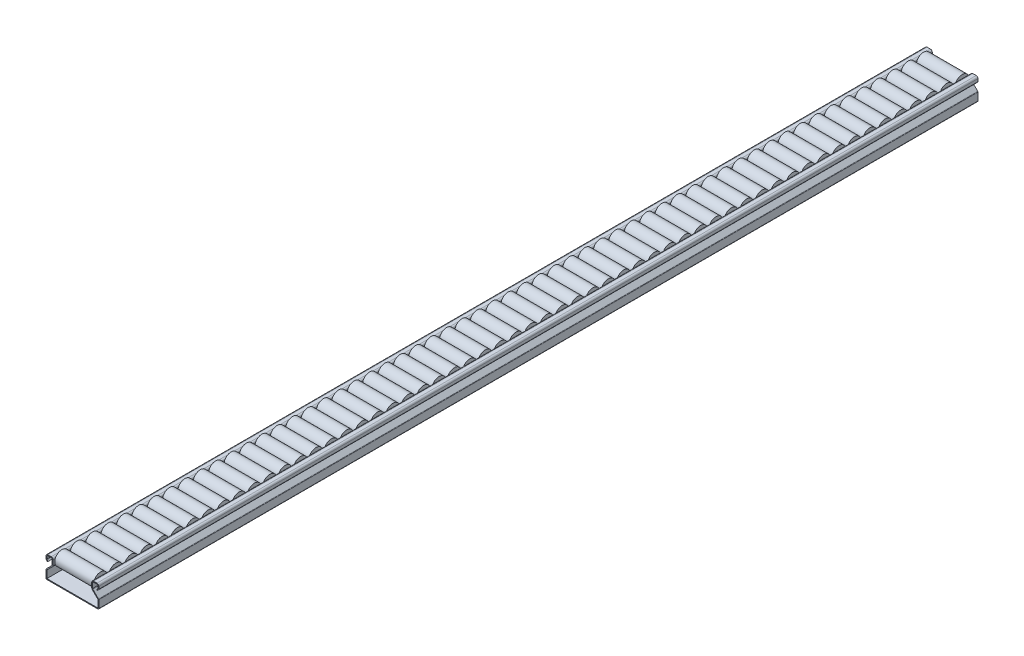
from build123d import *

# Parameters (mm, degrees)
BOSS_EXTRUDE1_DEPTH = 1000
CUT_EXTRUDE1_DEPTH  = 1001.762209518
CUT_EXTRUDE2_DEPTH  = 1001.762209518
SKETCH4_W           = 44
SKETCH4_H           = 8
SKETCH5_W           = 44
SKETCH5_H           = 8
SKETCH6_W           = 44
SKETCH6_H           = 8
SKETCH7_W           = 44
SKETCH7_H           = 8
SKETCH8_W           = 44
SKETCH8_H           = 8
SKETCH9_W           = 44
SKETCH9_H           = 8
SKETCH10_W          = 44
SKETCH10_H          = 8
SKETCH11_W          = 44
SKETCH11_H          = 8
SKETCH12_W          = 44
SKETCH12_H          = 8
SKETCH13_W          = 44
SKETCH13_H          = 8
SKETCH14_W          = 44
SKETCH14_H          = 8
SKETCH15_W          = 44
SKETCH15_H          = 8
SKETCH16_W          = 44
SKETCH16_H          = 8
SKETCH17_W          = 44
SKETCH17_H          = 8
SKETCH18_W          = 44
SKETCH18_H          = 8
SKETCH19_W          = 44
SKETCH19_H          = 8
SKETCH20_W          = 44
SKETCH20_H          = 8
SKETCH21_W          = 44
SKETCH21_H          = 8
SKETCH22_W          = 44
SKETCH22_H          = 8
SKETCH23_W          = 44
SKETCH23_H          = 8
SKETCH24_W          = 44
SKETCH24_H          = 8
SKETCH25_W          = 44
SKETCH25_H          = 8
SKETCH26_W          = 44
SKETCH26_H          = 8
SKETCH27_W          = 44
SKETCH27_H          = 8
SKETCH28_W          = 44
SKETCH28_H          = 8
SKETCH29_W          = 44
SKETCH29_H          = 8
SKETCH30_W          = 44
SKETCH30_H          = 8
SKETCH31_W          = 44
SKETCH31_H          = 8
SKETCH32_W          = 44
SKETCH32_H          = 8
SKETCH33_W          = 44
SKETCH33_H          = 8
SKETCH34_W          = 44
SKETCH34_H          = 8
SKETCH35_W          = 44
SKETCH35_H          = 8
SKETCH36_W          = 44
SKETCH36_H          = 8
SKETCH37_W          = 44
SKETCH37_H          = 8
SKETCH38_W          = 44
SKETCH38_H          = 8
SKETCH39_W          = 44
SKETCH39_H          = 8
SKETCH40_W          = 44
SKETCH40_H          = 8
SKETCH41_W          = 44
SKETCH41_H          = 8
SKETCH42_W          = 44
SKETCH42_H          = 8
SKETCH43_W          = 44
SKETCH43_H          = 8
SKETCH44_W          = 44
SKETCH44_H          = 8
SKETCH45_W          = 44
SKETCH45_H          = 8
SKETCH46_W          = 44
SKETCH46_H          = 8
SKETCH47_W          = 44
SKETCH47_H          = 8
SKETCH48_W          = 44
SKETCH48_H          = 8
SKETCH49_W          = 44
SKETCH49_H          = 8
SKETCH50_W          = 44
SKETCH50_H          = 8
SKETCH51_W          = 44
SKETCH51_H          = 8
SKETCH52_W          = 44
SKETCH52_H          = 8
SKETCH53_W          = 44
SKETCH53_H          = 8
SKETCH54_W          = 44
SKETCH54_H          = 8
SKETCH55_W          = 44
SKETCH55_H          = 8
SKETCH56_W          = 44
SKETCH56_H          = 8
SKETCH57_W          = 44
SKETCH57_H          = 8
SKETCH58_W          = 44
SKETCH58_H          = 8
SKETCH59_W          = 44
SKETCH59_H          = 8
SKETCH60_W          = 44
SKETCH60_H          = 8
FILLET1_R           = 1
FILLET2_R           = 2


with BuildPart() as part:
    # Sketch1 → Boss-Extrude1 (new body)
    with BuildSketch(Plane.XY.offset(1000)):
        with BuildLine():
            Line((30, 0), (30, 25))
            Line((30, 25), (24, 25))
            ThreePointArc((24, 25), (22.585786438, 24.414213562), (22, 23))
            Line((22, 23), (22, 17.414213562))
            ThreePointArc((22, 17.414213562), (22.152240935, 16.648846698), (22.585786438, 16))
            Line((22.585786438, 16), (29, 9.585786438))
            Line((29, 9.585786438), (29, 1))
            Line((29, 1), (-29, 1))
            Line((-29, 1), (-29, 9.585786438))
            Line((-29, 9.585786438), (-22.585786438, 16))
            ThreePointArc((-22.585786438, 16), (-22.152240935, 16.648846698), (-22, 17.414213562))
            Line((-22, 17.414213562), (-22, 23))
            ThreePointArc((-22, 23), (-22.585786438, 24.414213562), (-24, 25))
            Line((-24, 25), (-30, 25))
            Line((-30, 25), (-30, 0))
            Line((-30, 0), (30, 0))
        make_face()
    extrude(amount=-BOSS_EXTRUDE1_DEPTH)

    # Sketch2 → Cut-Extrude1 (cut, through all)
    with BuildSketch(Plane(origin=(0, 0, 0), x_dir=(-1, 0, 0), z_dir=(0, 0, -1))):
        Polygon((30, 10), (30, 19.585786438), (28.292893219, 17.878679656), (27.585786438, 18.585786438), (29, 20), (29, 24), (23, 24), (23, 17), align=None)
    extrude(amount=-CUT_EXTRUDE1_DEPTH, mode=Mode.SUBTRACT)

    # Sketch3 → Cut-Extrude2 (cut, through all)
    with BuildSketch(Plane(origin=(0, 0, 0), x_dir=(-1, 0, 0), z_dir=(0, 0, -1))):
        Polygon((-30, 19.585786438), (-30, 10), (-23, 17), (-23, 24), (-29, 24), (-29, 20), (-27.585786438, 18.585786438), (-28.292893219, 17.878679656), align=None)
    extrude(amount=-CUT_EXTRUDE2_DEPTH, mode=Mode.SUBTRACT)

    # Sketch4 → Revolve1 (revolve)
    with BuildSketch(Plane(origin=(0, 0, 10), x_dir=(-1, 0, 0), z_dir=(0, 0, -1))):
        with Locations((0, 24)):
            Rectangle(SKETCH4_W, SKETCH4_H)
    revolve(axis=Axis((22, 20, 10), (-1, 0, 0)))

    # Sketch5 → Revolve2 (revolve)
    with BuildSketch(Plane(origin=(0, 0, 990), x_dir=(-1, 0, 0), z_dir=(0, 0, -1))):
        with Locations((0, 24)):
            Rectangle(SKETCH5_W, SKETCH5_H)
    revolve(axis=Axis((22, 20, 990), (-1, 0, 0)))

    # Sketch6 → Revolve3 (revolve)
    with BuildSketch(Plane(origin=(0, 0, 27.5), x_dir=(-1, 0, 0), z_dir=(0, 0, -1))):
        with Locations((0, 24)):
            Rectangle(SKETCH6_W, SKETCH6_H)
    revolve(axis=Axis((22, 20, 27.5), (-1, 0, 0)))

    # Sketch7 → Revolve4 (revolve)
    with BuildSketch(Plane(origin=(0, 0, 45), x_dir=(-1, 0, 0), z_dir=(0, 0, -1))):
        with Locations((0, 24)):
            Rectangle(SKETCH7_W, SKETCH7_H)
    revolve(axis=Axis((22, 20, 45), (-1, 0, 0)))

    # Sketch8 → Revolve5 (revolve)
    with BuildSketch(Plane(origin=(0, 0, 62.5), x_dir=(-1, 0, 0), z_dir=(0, 0, -1))):
        with Locations((0, 24)):
            Rectangle(SKETCH8_W, SKETCH8_H)
    revolve(axis=Axis((22, 20, 62.5), (-1, 0, 0)))

    # Sketch9 → Revolve6 (revolve)
    with BuildSketch(Plane(origin=(0, 0, 80), x_dir=(-1, 0, 0), z_dir=(0, 0, -1))):
        with Locations((0, 24)):
            Rectangle(SKETCH9_W, SKETCH9_H)
    revolve(axis=Axis((22, 20, 80), (-1, 0, 0)))

    # Sketch10 → Revolve7 (revolve)
    with BuildSketch(Plane(origin=(0, 0, 97.5), x_dir=(-1, 0, 0), z_dir=(0, 0, -1))):
        with Locations((0, 24)):
            Rectangle(SKETCH10_W, SKETCH10_H)
    revolve(axis=Axis((22, 20, 97.5), (-1, 0, 0)))

    # Sketch11 → Revolve8 (revolve)
    with BuildSketch(Plane(origin=(0, 0, 115), x_dir=(-1, 0, 0), z_dir=(0, 0, -1))):
        with Locations((0, 24)):
            Rectangle(SKETCH11_W, SKETCH11_H)
    revolve(axis=Axis((22, 20, 115), (-1, 0, 0)))

    # Sketch12 → Revolve9 (revolve)
    with BuildSketch(Plane(origin=(0, 0, 132.5), x_dir=(-1, 0, 0), z_dir=(0, 0, -1))):
        with Locations((0, 24)):
            Rectangle(SKETCH12_W, SKETCH12_H)
    revolve(axis=Axis((22, 20, 132.5), (-1, 0, 0)))

    # Sketch13 → Revolve10 (revolve)
    with BuildSketch(Plane(origin=(0, 0, 150), x_dir=(-1, 0, 0), z_dir=(0, 0, -1))):
        with Locations((0, 24)):
            Rectangle(SKETCH13_W, SKETCH13_H)
    revolve(axis=Axis((22, 20, 150), (-1, 0, 0)))

    # Sketch14 → Revolve11 (revolve)
    with BuildSketch(Plane(origin=(0, 0, 167.5), x_dir=(-1, 0, 0), z_dir=(0, 0, -1))):
        with Locations((0, 24)):
            Rectangle(SKETCH14_W, SKETCH14_H)
    revolve(axis=Axis((22, 20, 167.5), (-1, 0, 0)))

    # Sketch15 → Revolve12 (revolve)
    with BuildSketch(Plane(origin=(0, 0, 185), x_dir=(-1, 0, 0), z_dir=(0, 0, -1))):
        with Locations((0, 24)):
            Rectangle(SKETCH15_W, SKETCH15_H)
    revolve(axis=Axis((22, 20, 185), (-1, 0, 0)))

    # Sketch16 → Revolve13 (revolve)
    with BuildSketch(Plane(origin=(0, 0, 202.5), x_dir=(-1, 0, 0), z_dir=(0, 0, -1))):
        with Locations((0, 24)):
            Rectangle(SKETCH16_W, SKETCH16_H)
    revolve(axis=Axis((22, 20, 202.5), (-1, 0, 0)))

    # Sketch17 → Revolve14 (revolve)
    with BuildSketch(Plane(origin=(0, 0, 220), x_dir=(-1, 0, 0), z_dir=(0, 0, -1))):
        with Locations((0, 24)):
            Rectangle(SKETCH17_W, SKETCH17_H)
    revolve(axis=Axis((22, 20, 220), (-1, 0, 0)))

    # Sketch18 → Revolve15 (revolve)
    with BuildSketch(Plane(origin=(0, 0, 237.5), x_dir=(-1, 0, 0), z_dir=(0, 0, -1))):
        with Locations((0, 24)):
            Rectangle(SKETCH18_W, SKETCH18_H)
    revolve(axis=Axis((22, 20, 237.5), (-1, 0, 0)))

    # Sketch19 → Revolve16 (revolve)
    with BuildSketch(Plane(origin=(0, 0, 255), x_dir=(-1, 0, 0), z_dir=(0, 0, -1))):
        with Locations((0, 24)):
            Rectangle(SKETCH19_W, SKETCH19_H)
    revolve(axis=Axis((22, 20, 255), (-1, 0, 0)))

    # Sketch20 → Revolve17 (revolve)
    with BuildSketch(Plane(origin=(0, 0, 272.5), x_dir=(-1, 0, 0), z_dir=(0, 0, -1))):
        with Locations((0, 24)):
            Rectangle(SKETCH20_W, SKETCH20_H)
    revolve(axis=Axis((22, 20, 272.5), (-1, 0, 0)))

    # Sketch21 → Revolve18 (revolve)
    with BuildSketch(Plane(origin=(0, 0, 290), x_dir=(-1, 0, 0), z_dir=(0, 0, -1))):
        with Locations((0, 24)):
            Rectangle(SKETCH21_W, SKETCH21_H)
    revolve(axis=Axis((22, 20, 290), (-1, 0, 0)))

    # Sketch22 → Revolve19 (revolve)
    with BuildSketch(Plane(origin=(0, 0, 307.5), x_dir=(-1, 0, 0), z_dir=(0, 0, -1))):
        with Locations((0, 24)):
            Rectangle(SKETCH22_W, SKETCH22_H)
    revolve(axis=Axis((22, 20, 307.5), (-1, 0, 0)))

    # Sketch23 → Revolve20 (revolve)
    with BuildSketch(Plane(origin=(0, 0, 325), x_dir=(-1, 0, 0), z_dir=(0, 0, -1))):
        with Locations((0, 24)):
            Rectangle(SKETCH23_W, SKETCH23_H)
    revolve(axis=Axis((22, 20, 325), (-1, 0, 0)))

    # Sketch24 → Revolve21 (revolve)
    with BuildSketch(Plane(origin=(0, 0, 342.5), x_dir=(-1, 0, 0), z_dir=(0, 0, -1))):
        with Locations((0, 24)):
            Rectangle(SKETCH24_W, SKETCH24_H)
    revolve(axis=Axis((22, 20, 342.5), (-1, 0, 0)))

    # Sketch25 → Revolve22 (revolve)
    with BuildSketch(Plane(origin=(0, 0, 360), x_dir=(-1, 0, 0), z_dir=(0, 0, -1))):
        with Locations((0, 24)):
            Rectangle(SKETCH25_W, SKETCH25_H)
    revolve(axis=Axis((22, 20, 360), (-1, 0, 0)))

    # Sketch26 → Revolve23 (revolve)
    with BuildSketch(Plane(origin=(0, 0, 377.5), x_dir=(-1, 0, 0), z_dir=(0, 0, -1))):
        with Locations((0, 24)):
            Rectangle(SKETCH26_W, SKETCH26_H)
    revolve(axis=Axis((22, 20, 377.5), (-1, 0, 0)))

    # Sketch27 → Revolve24 (revolve)
    with BuildSketch(Plane(origin=(0, 0, 395), x_dir=(-1, 0, 0), z_dir=(0, 0, -1))):
        with Locations((0, 24)):
            Rectangle(SKETCH27_W, SKETCH27_H)
    revolve(axis=Axis((22, 20, 395), (-1, 0, 0)))

    # Sketch28 → Revolve25 (revolve)
    with BuildSketch(Plane(origin=(0, 0, 412.5), x_dir=(-1, 0, 0), z_dir=(0, 0, -1))):
        with Locations((0, 24)):
            Rectangle(SKETCH28_W, SKETCH28_H)
    revolve(axis=Axis((22, 20, 412.5), (-1, 0, 0)))

    # Sketch29 → Revolve26 (revolve)
    with BuildSketch(Plane(origin=(0, 0, 430), x_dir=(-1, 0, 0), z_dir=(0, 0, -1))):
        with Locations((0, 24)):
            Rectangle(SKETCH29_W, SKETCH29_H)
    revolve(axis=Axis((22, 20, 430), (-1, 0, 0)))

    # Sketch30 → Revolve27 (revolve)
    with BuildSketch(Plane(origin=(0, 0, 447.5), x_dir=(-1, 0, 0), z_dir=(0, 0, -1))):
        with Locations((0, 24)):
            Rectangle(SKETCH30_W, SKETCH30_H)
    revolve(axis=Axis((22, 20, 447.5), (-1, 0, 0)))

    # Sketch31 → Revolve28 (revolve)
    with BuildSketch(Plane(origin=(0, 0, 465), x_dir=(-1, 0, 0), z_dir=(0, 0, -1))):
        with Locations((0, 24)):
            Rectangle(SKETCH31_W, SKETCH31_H)
    revolve(axis=Axis((22, 20, 465), (-1, 0, 0)))

    # Sketch32 → Revolve29 (revolve)
    with BuildSketch(Plane(origin=(0, 0, 482.5), x_dir=(-1, 0, 0), z_dir=(0, 0, -1))):
        with Locations((0, 24)):
            Rectangle(SKETCH32_W, SKETCH32_H)
    revolve(axis=Axis((22, 20, 482.5), (-1, 0, 0)))

    # Sketch33 → Revolve30 (revolve)
    with BuildSketch(Plane(origin=(0, 0, 500), x_dir=(-1, 0, 0), z_dir=(0, 0, -1))):
        with Locations((0, 24)):
            Rectangle(SKETCH33_W, SKETCH33_H)
    revolve(axis=Axis((22, 20, 500), (-1, 0, 0)))

    # Sketch34 → Revolve31 (revolve)
    with BuildSketch(Plane(origin=(0, 0, 517.5), x_dir=(-1, 0, 0), z_dir=(0, 0, -1))):
        with Locations((0, 24)):
            Rectangle(SKETCH34_W, SKETCH34_H)
    revolve(axis=Axis((22, 20, 517.5), (-1, 0, 0)))

    # Sketch35 → Revolve32 (revolve)
    with BuildSketch(Plane(origin=(0, 0, 535), x_dir=(-1, 0, 0), z_dir=(0, 0, -1))):
        with Locations((0, 24)):
            Rectangle(SKETCH35_W, SKETCH35_H)
    revolve(axis=Axis((22, 20, 535), (-1, 0, 0)))

    # Sketch36 → Revolve33 (revolve)
    with BuildSketch(Plane(origin=(0, 0, 552.5), x_dir=(-1, 0, 0), z_dir=(0, 0, -1))):
        with Locations((0, 24)):
            Rectangle(SKETCH36_W, SKETCH36_H)
    revolve(axis=Axis((22, 20, 552.5), (-1, 0, 0)))

    # Sketch37 → Revolve34 (revolve)
    with BuildSketch(Plane(origin=(0, 0, 570), x_dir=(-1, 0, 0), z_dir=(0, 0, -1))):
        with Locations((0, 24)):
            Rectangle(SKETCH37_W, SKETCH37_H)
    revolve(axis=Axis((22, 20, 570), (-1, 0, 0)))

    # Sketch38 → Revolve35 (revolve)
    with BuildSketch(Plane(origin=(0, 0, 587.5), x_dir=(-1, 0, 0), z_dir=(0, 0, -1))):
        with Locations((0, 24)):
            Rectangle(SKETCH38_W, SKETCH38_H)
    revolve(axis=Axis((22, 20, 587.5), (-1, 0, 0)))

    # Sketch39 → Revolve36 (revolve)
    with BuildSketch(Plane(origin=(0, 0, 605), x_dir=(-1, 0, 0), z_dir=(0, 0, -1))):
        with Locations((0, 24)):
            Rectangle(SKETCH39_W, SKETCH39_H)
    revolve(axis=Axis((22, 20, 605), (-1, 0, 0)))

    # Sketch40 → Revolve37 (revolve)
    with BuildSketch(Plane(origin=(0, 0, 622.5), x_dir=(-1, 0, 0), z_dir=(0, 0, -1))):
        with Locations((0, 24)):
            Rectangle(SKETCH40_W, SKETCH40_H)
    revolve(axis=Axis((22, 20, 622.5), (-1, 0, 0)))

    # Sketch41 → Revolve38 (revolve)
    with BuildSketch(Plane(origin=(0, 0, 640), x_dir=(-1, 0, 0), z_dir=(0, 0, -1))):
        with Locations((0, 24)):
            Rectangle(SKETCH41_W, SKETCH41_H)
    revolve(axis=Axis((22, 20, 640), (-1, 0, 0)))

    # Sketch42 → Revolve39 (revolve)
    with BuildSketch(Plane(origin=(0, 0, 657.5), x_dir=(-1, 0, 0), z_dir=(0, 0, -1))):
        with Locations((0, 24)):
            Rectangle(SKETCH42_W, SKETCH42_H)
    revolve(axis=Axis((22, 20, 657.5), (-1, 0, 0)))

    # Sketch43 → Revolve40 (revolve)
    with BuildSketch(Plane(origin=(0, 0, 675), x_dir=(-1, 0, 0), z_dir=(0, 0, -1))):
        with Locations((0, 24)):
            Rectangle(SKETCH43_W, SKETCH43_H)
    revolve(axis=Axis((22, 20, 675), (-1, 0, 0)))

    # Sketch44 → Revolve41 (revolve)
    with BuildSketch(Plane(origin=(0, 0, 692.5), x_dir=(-1, 0, 0), z_dir=(0, 0, -1))):
        with Locations((0, 24)):
            Rectangle(SKETCH44_W, SKETCH44_H)
    revolve(axis=Axis((22, 20, 692.5), (-1, 0, 0)))

    # Sketch45 → Revolve42 (revolve)
    with BuildSketch(Plane(origin=(0, 0, 710), x_dir=(-1, 0, 0), z_dir=(0, 0, -1))):
        with Locations((0, 24)):
            Rectangle(SKETCH45_W, SKETCH45_H)
    revolve(axis=Axis((22, 20, 710), (-1, 0, 0)))

    # Sketch46 → Revolve43 (revolve)
    with BuildSketch(Plane(origin=(0, 0, 727.5), x_dir=(-1, 0, 0), z_dir=(0, 0, -1))):
        with Locations((0, 24)):
            Rectangle(SKETCH46_W, SKETCH46_H)
    revolve(axis=Axis((22, 20, 727.5), (-1, 0, 0)))

    # Sketch47 → Revolve44 (revolve)
    with BuildSketch(Plane(origin=(0, 0, 745), x_dir=(-1, 0, 0), z_dir=(0, 0, -1))):
        with Locations((0, 24)):
            Rectangle(SKETCH47_W, SKETCH47_H)
    revolve(axis=Axis((22, 20, 745), (-1, 0, 0)))

    # Sketch48 → Revolve45 (revolve)
    with BuildSketch(Plane(origin=(0, 0, 762.5), x_dir=(-1, 0, 0), z_dir=(0, 0, -1))):
        with Locations((0, 24)):
            Rectangle(SKETCH48_W, SKETCH48_H)
    revolve(axis=Axis((22, 20, 762.5), (-1, 0, 0)))

    # Sketch49 → Revolve46 (revolve)
    with BuildSketch(Plane(origin=(0, 0, 780), x_dir=(-1, 0, 0), z_dir=(0, 0, -1))):
        with Locations((0, 24)):
            Rectangle(SKETCH49_W, SKETCH49_H)
    revolve(axis=Axis((22, 20, 780), (-1, 0, 0)))

    # Sketch50 → Revolve47 (revolve)
    with BuildSketch(Plane(origin=(0, 0, 797.5), x_dir=(-1, 0, 0), z_dir=(0, 0, -1))):
        with Locations((0, 24)):
            Rectangle(SKETCH50_W, SKETCH50_H)
    revolve(axis=Axis((22, 20, 797.5), (-1, 0, 0)))

    # Sketch51 → Revolve48 (revolve)
    with BuildSketch(Plane(origin=(0, 0, 815), x_dir=(-1, 0, 0), z_dir=(0, 0, -1))):
        with Locations((0, 24)):
            Rectangle(SKETCH51_W, SKETCH51_H)
    revolve(axis=Axis((22, 20, 815), (-1, 0, 0)))

    # Sketch52 → Revolve49 (revolve)
    with BuildSketch(Plane(origin=(0, 0, 832.5), x_dir=(-1, 0, 0), z_dir=(0, 0, -1))):
        with Locations((0, 24)):
            Rectangle(SKETCH52_W, SKETCH52_H)
    revolve(axis=Axis((22, 20, 832.5), (-1, 0, 0)))

    # Sketch53 → Revolve50 (revolve)
    with BuildSketch(Plane(origin=(0, 0, 850), x_dir=(-1, 0, 0), z_dir=(0, 0, -1))):
        with Locations((0, 24)):
            Rectangle(SKETCH53_W, SKETCH53_H)
    revolve(axis=Axis((22, 20, 850), (-1, 0, 0)))

    # Sketch54 → Revolve51 (revolve)
    with BuildSketch(Plane(origin=(0, 0, 867.5), x_dir=(-1, 0, 0), z_dir=(0, 0, -1))):
        with Locations((0, 24)):
            Rectangle(SKETCH54_W, SKETCH54_H)
    revolve(axis=Axis((22, 20, 867.5), (-1, 0, 0)))

    # Sketch55 → Revolve52 (revolve)
    with BuildSketch(Plane(origin=(0, 0, 885), x_dir=(-1, 0, 0), z_dir=(0, 0, -1))):
        with Locations((0, 24)):
            Rectangle(SKETCH55_W, SKETCH55_H)
    revolve(axis=Axis((22, 20, 885), (-1, 0, 0)))

    # Sketch56 → Revolve53 (revolve)
    with BuildSketch(Plane(origin=(0, 0, 902.5), x_dir=(-1, 0, 0), z_dir=(0, 0, -1))):
        with Locations((0, 24)):
            Rectangle(SKETCH56_W, SKETCH56_H)
    revolve(axis=Axis((22, 20, 902.5), (-1, 0, 0)))

    # Sketch57 → Revolve54 (revolve)
    with BuildSketch(Plane(origin=(0, 0, 920), x_dir=(-1, 0, 0), z_dir=(0, 0, -1))):
        with Locations((0, 24)):
            Rectangle(SKETCH57_W, SKETCH57_H)
    revolve(axis=Axis((22, 20, 920), (-1, 0, 0)))

    # Sketch58 → Revolve55 (revolve)
    with BuildSketch(Plane(origin=(0, 0, 937.5), x_dir=(-1, 0, 0), z_dir=(0, 0, -1))):
        with Locations((0, 24)):
            Rectangle(SKETCH58_W, SKETCH58_H)
    revolve(axis=Axis((22, 20, 937.5), (-1, 0, 0)))

    # Sketch59 → Revolve56 (revolve)
    with BuildSketch(Plane(origin=(0, 0, 955), x_dir=(-1, 0, 0), z_dir=(0, 0, -1))):
        with Locations((0, 24)):
            Rectangle(SKETCH59_W, SKETCH59_H)
    revolve(axis=Axis((22, 20, 955), (-1, 0, 0)))

    # Sketch60 → Revolve57 (revolve)
    with BuildSketch(Plane(origin=(0, 0, 972.5), x_dir=(-1, 0, 0), z_dir=(0, 0, -1))):
        with Locations((0, 24)):
            Rectangle(SKETCH60_W, SKETCH60_H)
    revolve(axis=Axis((22, 20, 972.5), (-1, 0, 0)))

    # Fillet1
    fillet1_edges = [part.edges().sort_by_distance(p)[0] for p in [
        (23, 24, 500),
        (-23, 24, 500),
        (29, 20, 500),
        (30, 19.585786438, 500),
        (-23, 17, 500),
        (23, 17, 500),
        (-30, 19.585786438, 500),
        (29, 24, 500),
        (-29, 20, 500),
        (-29, 24, 500),
        (30, 0, 500),
        (30, 10, 500),
        (-30, 10, 500),
        (-30, 0, 500),
    ]]
    fillet(fillet1_edges, radius=FILLET1_R)

    # Fillet2
    fillet2_edges = [part.edges().sort_by_distance(p)[0] for p in [
        (30, 25, 500),
        (-30, 25, 500),
    ]]
    fillet(fillet2_edges, radius=FILLET2_R)


solid = part.part
